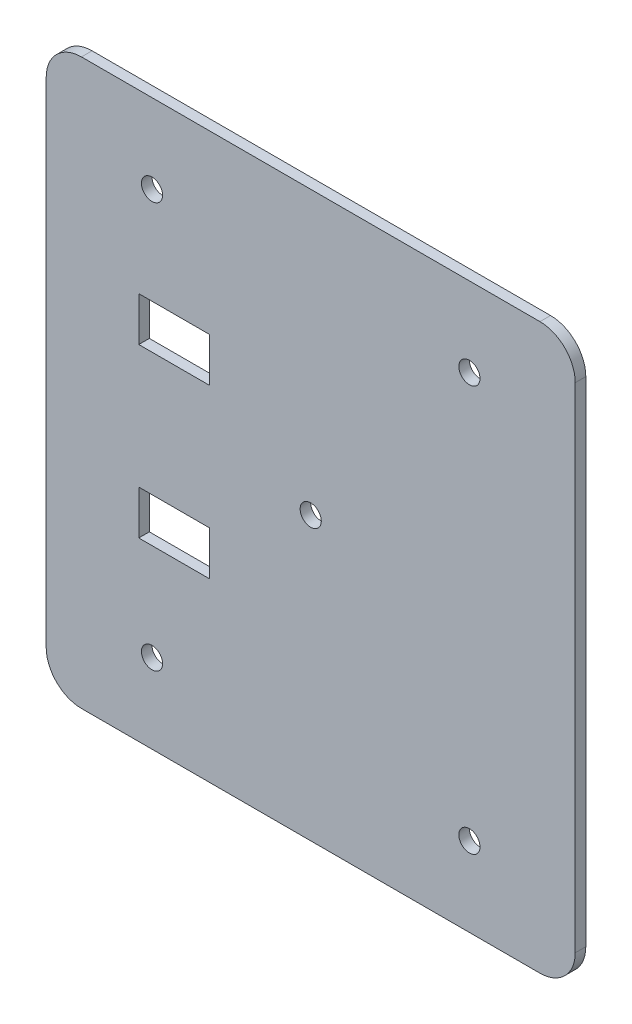
from build123d import *

# Parameters (mm, degrees)
SKETCH1_R           = 6
SKETCH1_W           = 32
SKETCH1_H           = 25
BOSS_EXTRUDE1_DEPTH = 6
SKETCH2_W           = 40
SKETCH2_H           = 25
CUT_EXTRUDE1_DEPTH  = 314.712049498


with BuildPart() as part:
    # Sketch1 → Boss-Extrude1 (new body)
    with BuildSketch(Plane.XY):
        with BuildLine():
            ThreePointArc((205, -102.5), (219.142135624, -96.642135624), (225, -82.5))
            Line((225, -82.5), (225, 197.5))
            ThreePointArc((225, 197.5), (219.142135624, 211.642135624), (205, 217.5))
            Line((205, 217.5), (-55, 217.5))
            ThreePointArc((-55, 217.5), (-69.142135624, 211.642135624), (-75, 197.5))
            Line((-75, 197.5), (-75, -82.5))
            ThreePointArc((-75, -82.5), (-69.142135624, -96.642135624), (-55, -102.5))
            Line((-55, -102.5), (205, -102.5))
        make_face()
        Polygon((-22.5, -2.5), (-22.5, 22.5), (0, 22.5), (9.5, 22.5), (9.5, -2.5), align=None, mode=Mode.SUBTRACT)
        with Locations((-15, -57.5)):
            Circle(SKETCH1_R, mode=Mode.SUBTRACT)
        with Locations((-15, 172.5)):
            Circle(SKETCH1_R, mode=Mode.SUBTRACT)
        with Locations((75, 57.5)):
            Circle(SKETCH1_R, mode=Mode.SUBTRACT)
        with Locations((-6.5, 105)):
            Rectangle(SKETCH1_W, SKETCH1_H, mode=Mode.SUBTRACT)
        with Locations((165, 172.5)):
            Circle(SKETCH1_R, mode=Mode.SUBTRACT)
        with Locations((165, -57.5)):
            Circle(SKETCH1_R, mode=Mode.SUBTRACT)
    extrude(amount=BOSS_EXTRUDE1_DEPTH)

    # Sketch2 → Cut-Extrude1 (cut, through all)
    with BuildSketch(Plane.XY.offset(22)):
        with Locations((-2.5, 10)):
            Rectangle(SKETCH2_W, SKETCH2_H)
        with Locations((-2.5, 104.99977592)):
            Rectangle(SKETCH2_W, SKETCH2_H)
    extrude(amount=-CUT_EXTRUDE1_DEPTH, mode=Mode.SUBTRACT)


solid = part.part
